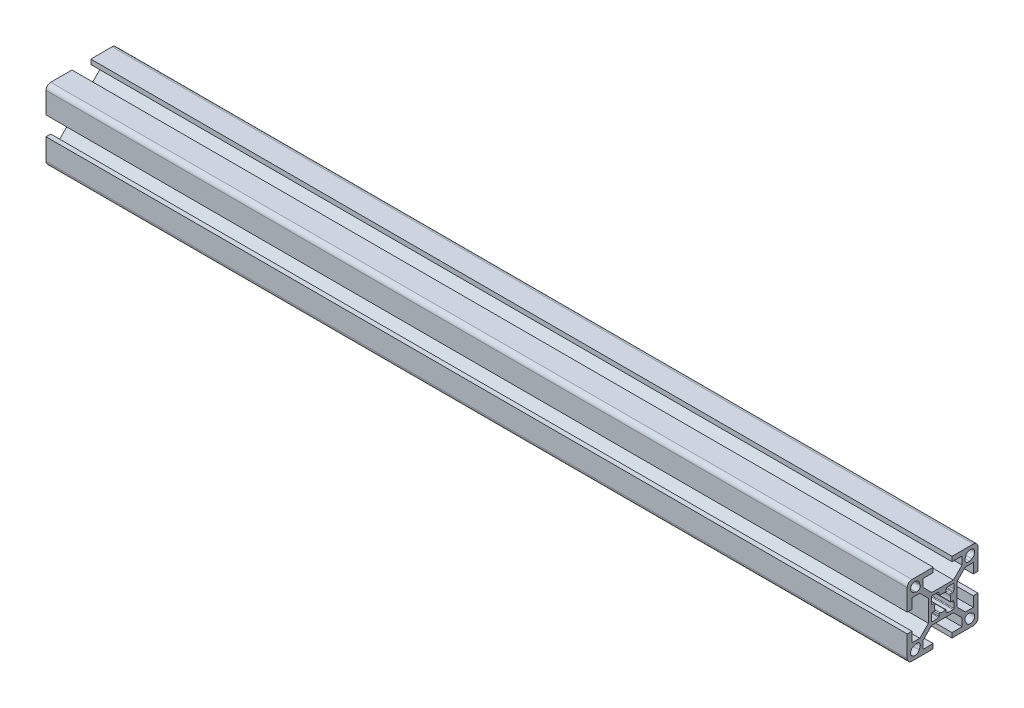
from build123d import *

# Parameters (mm, degrees)
BOSS_EXTRUDE1_DEPTH = 365


with BuildPart() as part:
    # Sketch1 → Boss-Extrude1 (new body)
    with BuildSketch(Plane(origin=(0, 0, 0), x_dir=(0, 0, -1), z_dir=(1, 0, 0))):
        with BuildLine():
            Line((-15, 13), (-15, 4))
            Line((-15, 4), (-13, 4))
            Line((-13, 4), (-13, 8.25))
            Line((-13, 8.25), (-9.664213562, 8.25))
            Line((-9.664213562, 8.25), (-6, 4.585786438))
            Line((-6, 4.585786438), (-6, -4.585786438))
            Line((-6, -4.585786438), (-9.664213562, -8.25))
            Line((-9.664213562, -8.25), (-13, -8.25))
            Line((-13, -8.25), (-13, -4))
            Line((-13, -4), (-15, -4))
            Line((-15, -4), (-15, -13))
            ThreePointArc((-15, -13), (-14.414213562, -14.414213562), (-13, -15))
            Line((-13, -15), (-4, -15))
            Line((-4, -15), (-4, -13))
            Line((-4, -13), (-8.25, -13))
            Line((-8.25, -13), (-8.25, -9.664213562))
            Line((-8.25, -9.664213562), (-4.585786438, -6))
            Line((-4.585786438, -6), (4.585786438, -6))
            Line((4.585786438, -6), (8.25, -9.664213562))
            Line((8.25, -9.664213562), (8.25, -13))
            Line((8.25, -13), (4, -13))
            Line((4, -13), (4, -15))
            Line((4, -15), (13, -15))
            ThreePointArc((13, -15), (14.414213562, -14.414213562), (15, -13))
            Line((15, -13), (15, -4))
            Line((15, -4), (13, -4))
            Line((13, -4), (13, -8.25))
            Line((13, -8.25), (9.664213562, -8.25))
            Line((9.664213562, -8.25), (6, -4.585786438))
            Line((6, -4.585786438), (6, 4.585786438))
            Line((6, 4.585786438), (9.664213562, 8.25))
            Line((9.664213562, 8.25), (13, 8.25))
            Line((13, 8.25), (13, 4))
            Line((13, 4), (15, 4))
            Line((15, 4), (15, 13))
            ThreePointArc((15, 13), (14.414213562, 14.414213562), (13, 15))
            Line((13, 15), (4, 15))
            Line((4, 15), (4, 13))
            Line((4, 13), (8.25, 13))
            Line((8.25, 13), (8.25, 9.664213562))
            Line((8.25, 9.664213562), (4.585786438, 6))
            Line((4.585786438, 6), (-4.585786438, 6))
            Line((-4.585786438, 6), (-8.25, 9.664213562))
            Line((-8.25, 9.664213562), (-8.25, 13))
            Line((-8.25, 13), (-4, 13))
            Line((-4, 13), (-4, 15))
            Line((-4, 15), (-13, 15))
            ThreePointArc((-13, 15), (-14.414213562, 14.414213562), (-15, 13))
        make_face()
        with BuildLine():
            Line((-9.539070071, 11.338915743), (-9.918883282, 12.361530981))
            ThreePointArc((-9.918883282, 12.361530981), (-13.043502884, 13.043502884), (-12.361530981, 9.918883282))
            Line((-12.361530981, 9.918883282), (-11.338915743, 9.539070071))
            ThreePointArc((-11.338915743, 9.539070071), (-9.861522369, 9.861522369), (-9.539070071, 11.338915743))
        make_face(mode=Mode.SUBTRACT)
        with BuildLine():
            Line((9.918883282, 12.361530981), (9.539070071, 11.338915743))
            ThreePointArc((9.539070071, 11.338915743), (9.861522369, 9.861522369), (11.338915743, 9.539070071))
            Line((11.338915743, 9.539070071), (12.361530981, 9.918883282))
            ThreePointArc((12.361530981, 9.918883282), (13.043502884, 13.043502884), (9.918883282, 12.361530981))
        make_face(mode=Mode.SUBTRACT)
        with BuildLine():
            Line((12.361530981, -9.918883282), (11.338915743, -9.539070071))
            ThreePointArc((11.338915743, -9.539070071), (9.861522369, -9.861522369), (9.539070071, -11.338915743))
            Line((9.539070071, -11.338915743), (9.918883282, -12.361530981))
            ThreePointArc((9.918883282, -12.361530981), (13.043502884, -13.043502884), (12.361530981, -9.918883282))
        make_face(mode=Mode.SUBTRACT)
        with BuildLine():
            Line((-11.338915743, -9.539070071), (-12.361530981, -9.918883282))
            ThreePointArc((-12.361530981, -9.918883282), (-13.043502884, -13.043502884), (-9.918883282, -12.361530981))
            Line((-9.918883282, -12.361530981), (-9.539070071, -11.338915743))
            ThreePointArc((-9.539070071, -11.338915743), (-9.861522369, -9.861522369), (-11.338915743, -9.539070071))
        make_face(mode=Mode.SUBTRACT)
        with BuildLine():
            Line((-4.8, -2.644433572), (-4.8, -4.5))
            ThreePointArc((-4.8, -4.5), (-4.712132034, -4.712132034), (-4.5, -4.8))
            Line((-4.5, -4.8), (-2.644433572, -4.8))
            ThreePointArc((-2.644433572, -4.8), (-2.615679847, -4.79861886), (-2.587190874, -4.794488155))
            Line((-2.587190874, -4.794488155), (-1.742757301, -4.630346896))
            ThreePointArc((-1.742757301, -4.630346896), (-1.568512625, -4.526682207), (-1.5, -4.335858741))
            Line((-1.5, -4.335858741), (-1.5, -3.5))
            ThreePointArc((-1.5, -3.5), (-1.374371458, -3.255879959), (-1.102702703, -3.216216216))
            ThreePointArc((-1.102702703, -3.216216216), (0, -3.4), (1.102702703, -3.216216216))
            ThreePointArc((1.102702703, -3.216216216), (1.374371458, -3.255879959), (1.5, -3.5))
            Line((1.5, -3.5), (1.5, -4.335858741))
            ThreePointArc((1.5, -4.335858741), (1.568512625, -4.526682207), (1.742757301, -4.630346896))
            Line((1.742757301, -4.630346896), (2.587190874, -4.794488155))
            ThreePointArc((2.587190874, -4.794488155), (2.615679847, -4.79861886), (2.644433572, -4.8))
            Line((2.644433572, -4.8), (4.5, -4.8))
            ThreePointArc((4.5, -4.8), (4.712132034, -4.712132034), (4.8, -4.5))
            Line((4.8, -4.5), (4.8, -2.644433572))
            ThreePointArc((4.8, -2.644433572), (4.79861886, -2.615679847), (4.794488155, -2.587190874))
            Line((4.794488155, -2.587190874), (4.630346896, -1.742757301))
            ThreePointArc((4.630346896, -1.742757301), (4.526682207, -1.568512625), (4.335858741, -1.5))
            Line((4.335858741, -1.5), (3.5, -1.5))
            ThreePointArc((3.5, -1.5), (3.255879959, -1.374371458), (3.216216216, -1.102702703))
            ThreePointArc((3.216216216, -1.102702703), (3.4, 0), (3.216216216, 1.102702703))
            ThreePointArc((3.216216216, 1.102702703), (3.255879959, 1.374371458), (3.5, 1.5))
            Line((3.5, 1.5), (4.335858741, 1.5))
            ThreePointArc((4.335858741, 1.5), (4.526682207, 1.568512625), (4.630346896, 1.742757301))
            Line((4.630346896, 1.742757301), (4.794488155, 2.587190874))
            ThreePointArc((4.794488155, 2.587190874), (4.79861886, 2.615679847), (4.8, 2.644433572))
            Line((4.8, 2.644433572), (4.8, 4.5))
            ThreePointArc((4.8, 4.5), (4.712132034, 4.712132034), (4.5, 4.8))
            Line((4.5, 4.8), (2.644433572, 4.8))
            ThreePointArc((2.644433572, 4.8), (2.615679847, 4.79861886), (2.587190874, 4.794488155))
            Line((2.587190874, 4.794488155), (1.742757301, 4.630346896))
            ThreePointArc((1.742757301, 4.630346896), (1.568512625, 4.526682207), (1.5, 4.335858741))
            Line((1.5, 4.335858741), (1.5, 3.5))
            ThreePointArc((1.5, 3.5), (1.374371458, 3.255879959), (1.102702703, 3.216216216))
            ThreePointArc((1.102702703, 3.216216216), (0, 3.4), (-1.102702703, 3.216216216))
            ThreePointArc((-1.102702703, 3.216216216), (-1.374371458, 3.255879959), (-1.5, 3.5))
            Line((-1.5, 3.5), (-1.5, 4.335858741))
            ThreePointArc((-1.5, 4.335858741), (-1.568512625, 4.526682207), (-1.742757301, 4.630346896))
            Line((-1.742757301, 4.630346896), (-2.587190874, 4.794488155))
            ThreePointArc((-2.587190874, 4.794488155), (-2.615679847, 4.79861886), (-2.644433572, 4.8))
            Line((-2.644433572, 4.8), (-4.5, 4.8))
            ThreePointArc((-4.5, 4.8), (-4.712132034, 4.712132034), (-4.8, 4.5))
            Line((-4.8, 4.5), (-4.8, 2.644433572))
            ThreePointArc((-4.8, 2.644433572), (-4.79861886, 2.615679847), (-4.794488155, 2.587190874))
            Line((-4.794488155, 2.587190874), (-4.630346896, 1.742757301))
            ThreePointArc((-4.630346896, 1.742757301), (-4.526682207, 1.568512625), (-4.335858741, 1.5))
            Line((-4.335858741, 1.5), (-3.5, 1.5))
            ThreePointArc((-3.5, 1.5), (-3.255879959, 1.374371458), (-3.216216216, 1.102702703))
            ThreePointArc((-3.216216216, 1.102702703), (-3.4, 0), (-3.216216216, -1.102702703))
            ThreePointArc((-3.216216216, -1.102702703), (-3.255879959, -1.374371458), (-3.5, -1.5))
            Line((-3.5, -1.5), (-4.335858741, -1.5))
            ThreePointArc((-4.335858741, -1.5), (-4.526682207, -1.568512625), (-4.630346896, -1.742757301))
            Line((-4.630346896, -1.742757301), (-4.794488155, -2.587190874))
            ThreePointArc((-4.794488155, -2.587190874), (-4.79861886, -2.615679847), (-4.8, -2.644433572))
        make_face(mode=Mode.SUBTRACT)
    extrude(amount=BOSS_EXTRUDE1_DEPTH)


solid = part.part
